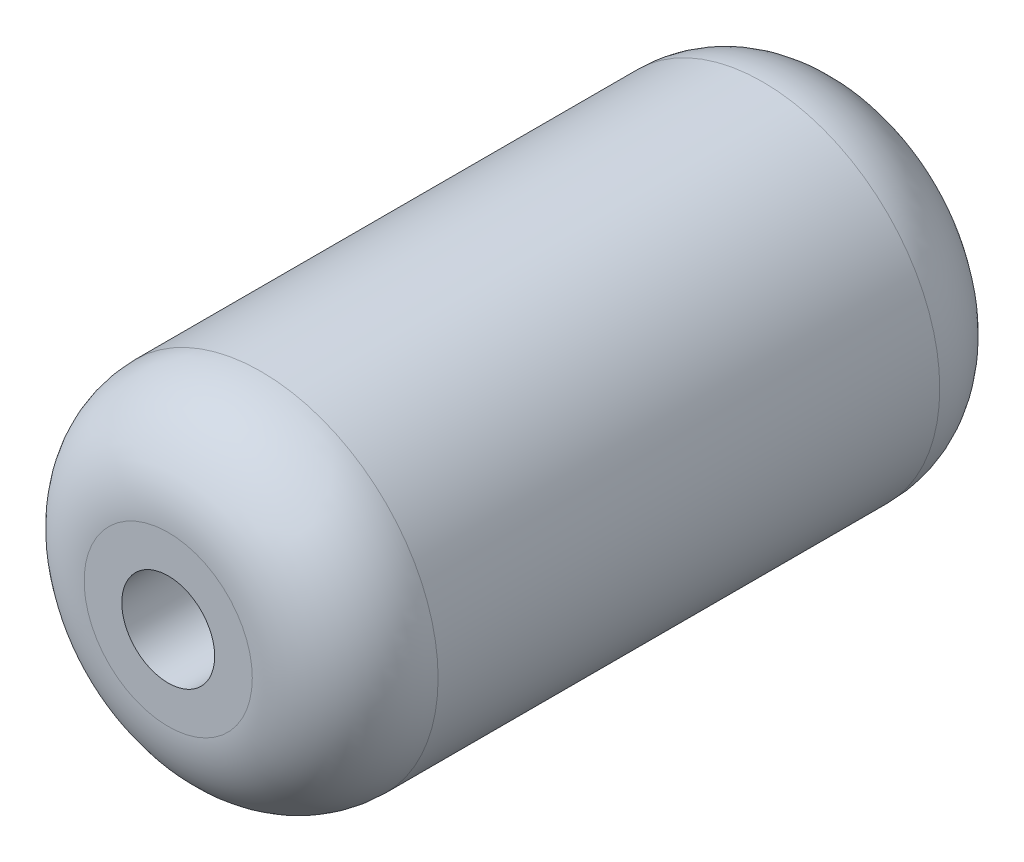
from build123d import *

# Parameters (mm, degrees)
CROQUIS1_R              = 19.05
CROQUIS1_R_2            = 5
SALIENTE_EXTRUIR1_DEPTH = 74
REDONDEO1_R             = 10


with BuildPart() as part:
    # Croquis1 → Saliente-Extruir1 (new body)
    with BuildSketch(Plane.XY):
        Circle(CROQUIS1_R)
        Circle(CROQUIS1_R_2, mode=Mode.SUBTRACT)
    extrude(amount=SALIENTE_EXTRUIR1_DEPTH)

    # Redondeo1
    redondeo1_edges = [part.edges().sort_by_distance(p)[0] for p in [
        (-19.05, 0, 74),
        (-19.05, 0, 0),
    ]]
    fillet(redondeo1_edges, radius=REDONDEO1_R)


solid = part.part
